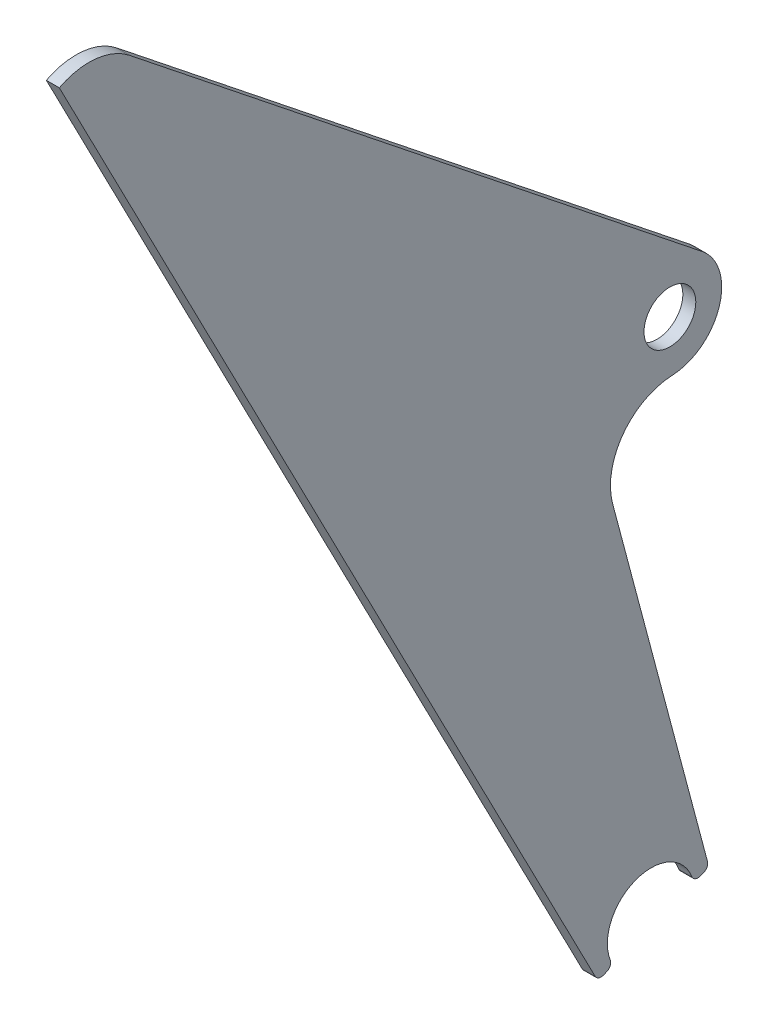
from build123d import *

# Parameters (mm, degrees)
SKETCH_1_R             = 8
SM_BASE_FLANGE_1_DEPTH = 4


# Sheet-metal steps are written as plain solids
with BuildPart() as part:
    # Sketch 1 → Базовая кромка1 (new body)
    with BuildSketch(Plane(origin=(0, 0, 0), x_dir=(0, 0, -1), z_dir=(1, 0, 0))):
        with BuildLine():
            Line((-161.097577427, 311.348014413), (15.777028295, 170.442439889))
            ThreePointArc((15.777028295, 170.442439889), (21.027340211, 152.992649587), (6.535875187, 141.944645322))
            ThreePointArc((6.535875187, 141.944645322), (-8.680633455, 133.794281683), (-11.883786143, 116.832254223))
            Line((-11.883786143, 116.832254223), (17.41991669, 6.481832542))
            ThreePointArc((17.41991669, 6.481832542), (17.268656425, 5.060014039), (16.206724964, 4.102543887))
            Line((16.206724964, 4.102543887), (15.1830333, 3.707647452))
            ThreePointArc((15.1830333, 3.707647452), (13.65244827, 3.7453323), (12.596997586, 4.854446603))
            ThreePointArc((12.596997586, 4.854446603), (-4.858743487, 12.595340874), (-12.593682696, -4.863039806))
            ThreePointArc((-12.593682696, -4.863039806), (-12.630845419, -6.393637603), (-13.739599615, -7.449466574))
            Line((-13.739599615, -7.449466574), (-14.763291279, -7.844363009))
            ThreePointArc((-14.763291279, -7.844363009), (-16.19312815, -7.848110442), (-17.26006382, -6.896219798))
            Line((-17.26006382, -6.896219798), (-182.737745394, 313.474626916))
            ThreePointArc((-182.737745394, 313.474626916), (-171.603404739, 315.609160958), (-161.097577427, 311.348014413))
        make_face()
        with Locations((5.807559646, 157.928060366)):
            Circle(SKETCH_1_R, mode=Mode.SUBTRACT)
    extrude(amount=SM_BASE_FLANGE_1_DEPTH)


solid = part.part
